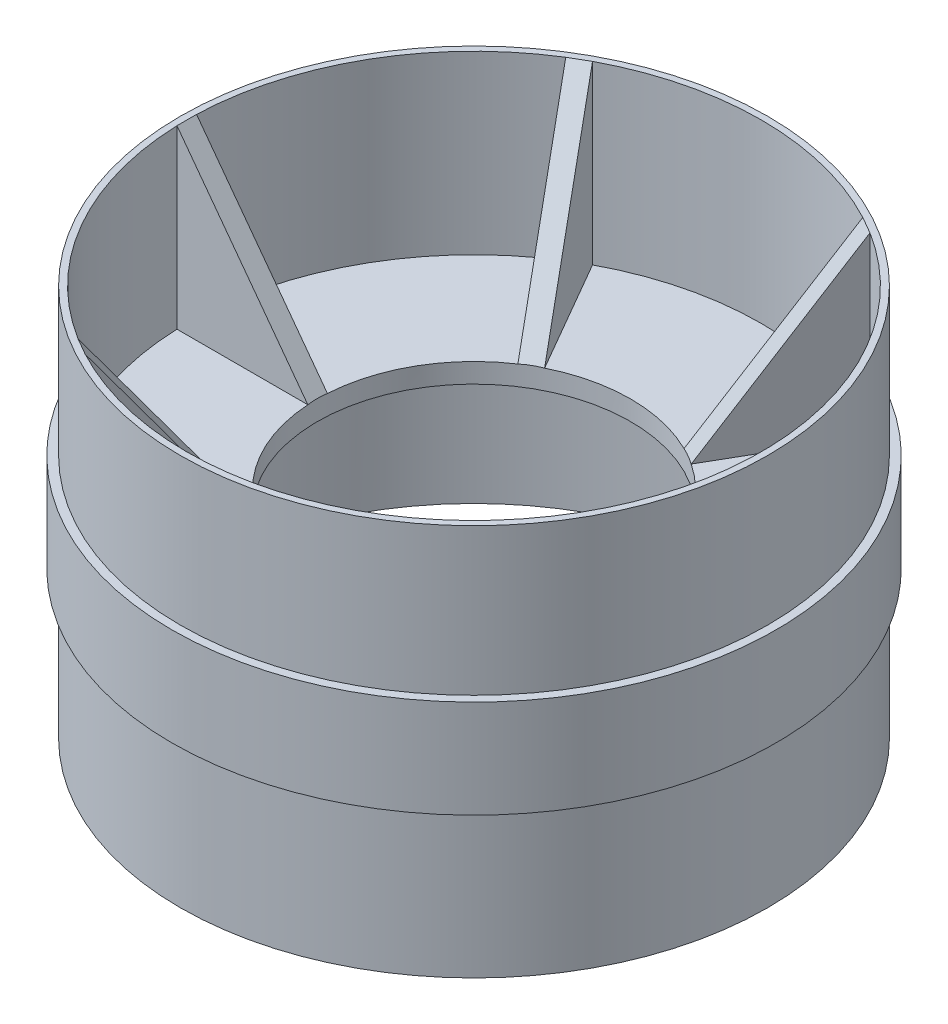
from build123d import *

# Parameters (mm, degrees)
SKETCH1_R            = 78.359
SKETCH1_R_2          = 74.549
BOSS_EXTRUDE1_DEPTH  = 25.4
SKETCH2_R            = 76.2
SKETCH2_R_2          = 74.549
BOSS_EXTRUDE2_DEPTH  = 38.1
BOSS_EXTRUDE3_START  = 38.1
SKETCH3_R            = 76.2
SKETCH3_R_2          = 74.549
BOSS_EXTRUDE3_DEPTH  = 38.1
SKETCH4_R            = 74.549
SKETCH4_R_2          = 40.64
BOSS_EXTRUDE4_DEPTH  = 5.08
BOSS_EXTRUDE10_DEPTH = 45.72
CUT_EXTRUDE1_DEPTH   = 5.08
CIRPATTERN1_COUNT    = 6


with BuildPart() as part:
    # Sketch1 → Boss-Extrude1 (new body)
    with BuildSketch(Plane(origin=(0, 0, 0), x_dir=(1, 0, 0), z_dir=(0, 1, 0))):
        Circle(SKETCH1_R)
        Circle(SKETCH1_R_2, mode=Mode.SUBTRACT)
    extrude(amount=BOSS_EXTRUDE1_DEPTH)

    # Sketch2 → Boss-Extrude2 (add)
    with BuildSketch(Plane(origin=(0, 25.4, 0), x_dir=(1, 0, 0), z_dir=(0, 1, 0))):
        Circle(SKETCH2_R)
        Circle(SKETCH2_R_2, mode=Mode.SUBTRACT)
    extrude(amount=BOSS_EXTRUDE2_DEPTH)

    # Sketch3 → Boss-Extrude3 (add)
    with BuildSketch(Plane.XZ.offset(BOSS_EXTRUDE3_START)):
        Circle(SKETCH3_R)
        Circle(SKETCH3_R_2, mode=Mode.SUBTRACT)
    extrude(amount=-BOSS_EXTRUDE3_DEPTH)

    # Sketch4 → Boss-Extrude4 (add)
    with BuildSketch(Plane(origin=(0, 12.7, 0), x_dir=(1, 0, 0), z_dir=(0, 1, 0))):
        Circle(SKETCH4_R)
        Circle(SKETCH4_R_2, mode=Mode.SUBTRACT)
    extrude(amount=BOSS_EXTRUDE4_DEPTH)

    # Sketch5 → Boss-Extrude10 (add)
    with BuildSketch(Plane(origin=(0, 17.78, 0), x_dir=(1, 0, 0), z_dir=(0, 1, 0))):
        with BuildLine():
            Line((40.560547334, 2.54), (74.505716566, 2.54))
            ThreePointArc((74.505716566, 2.54), (74.549, 0), (74.505716566, -2.54))
            Line((74.505716566, -2.54), (40.560547334, -2.54))
            ThreePointArc((40.560547334, -2.54), (40.64, 0), (40.560547334, 2.54))
        make_face()
        with BuildLine():
            Line((22.479978192, -33.856464382), (39.452562809, -63.253843273))
            ThreePointArc((39.452562809, -63.253843273), (37.2745, -64.561327827), (35.053153757, -65.793843273))
            Line((35.053153757, -65.793843273), (18.080569141, -36.396464382))
            ThreePointArc((18.080569141, -36.396464382), (20.32, -35.19527241), (22.479978192, -33.856464382))
        make_face()
        with BuildLine():
            Line((-18.080569141, -36.396464382), (-35.053153757, -65.793843273))
            ThreePointArc((-35.053153757, -65.793843273), (-37.2745, -64.561327827), (-39.452562809, -63.253843273))
            Line((-39.452562809, -63.253843273), (-22.479978192, -33.856464382))
            ThreePointArc((-22.479978192, -33.856464382), (-20.32, -35.19527241), (-18.080569141, -36.396464382))
        make_face()
        with BuildLine():
            Line((-40.560547334, -2.54), (-74.505716566, -2.54))
            ThreePointArc((-74.505716566, -2.54), (-74.549, 0), (-74.505716566, 2.54))
            Line((-74.505716566, 2.54), (-40.560547334, 2.54))
            ThreePointArc((-40.560547334, 2.54), (-40.64, 0), (-40.560547334, -2.54))
        make_face()
        with BuildLine():
            Line((-22.479978192, 33.856464382), (-39.452562809, 63.253843273))
            ThreePointArc((-39.452562809, 63.253843273), (-37.2745, 64.561327827), (-35.053153757, 65.793843273))
            Line((-35.053153757, 65.793843273), (-18.080569141, 36.396464382))
            ThreePointArc((-18.080569141, 36.396464382), (-20.32, 35.19527241), (-22.479978192, 33.856464382))
        make_face()
        with BuildLine():
            Line((18.080569141, 36.396464382), (35.053153757, 65.793843273))
            ThreePointArc((35.053153757, 65.793843273), (37.2745, 64.561327827), (39.452562809, 63.253843273))
            Line((39.452562809, 63.253843273), (22.479978192, 33.856464382))
            ThreePointArc((22.479978192, 33.856464382), (20.32, 35.19527241), (18.080569141, 36.396464382))
        make_face()
    extrude(amount=BOSS_EXTRUDE10_DEPTH)

    # Sketch6 → Cut-Extrude1 (cut)
    with BuildSketch(Plane.XY.offset(2.54)):
        Polygon((74.505716566, 63.5), (40.560547334, 17.78), (40.560547334, 63.5), align=None)
    cut_extrude1 = extrude(amount=-CUT_EXTRUDE1_DEPTH, mode=Mode.SUBTRACT)

    # CirPattern1: Cut-Extrude1 ×6 about axis
    cirpattern1_axis = Axis((0, 12.7, 0), (0, 1, 0))
    for i in range(1, CIRPATTERN1_COUNT):
        add(cut_extrude1.rotate(cirpattern1_axis, i * 360 / CIRPATTERN1_COUNT), mode=Mode.SUBTRACT)


solid = part.part
